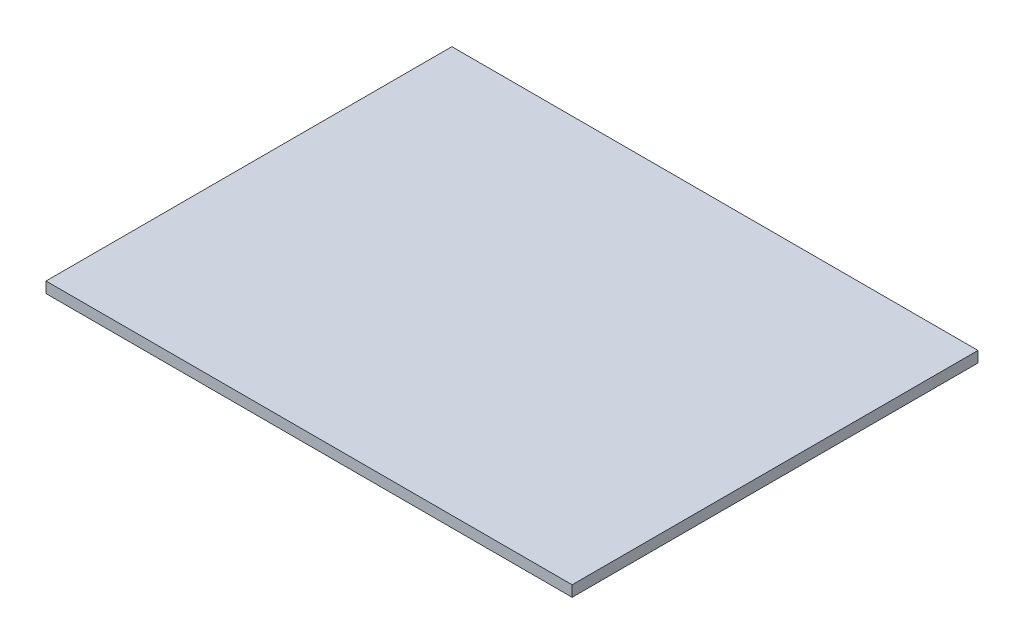
from build123d import *

# Parameters (mm, degrees)
ESQUISSE1_W        = 70
ESQUISSE1_H        = 54
BOSS_EXTRU_1_DEPTH = 1.45


with BuildPart() as part:
    # Esquisse1 → Boss.-Extru.1 (new body)
    with BuildSketch(Plane(origin=(0, 0, 0), x_dir=(1, 0, 0), z_dir=(0, 1, 0))):
        Rectangle(ESQUISSE1_W, ESQUISSE1_H)
    extrude(amount=BOSS_EXTRU_1_DEPTH)


solid = part.part
